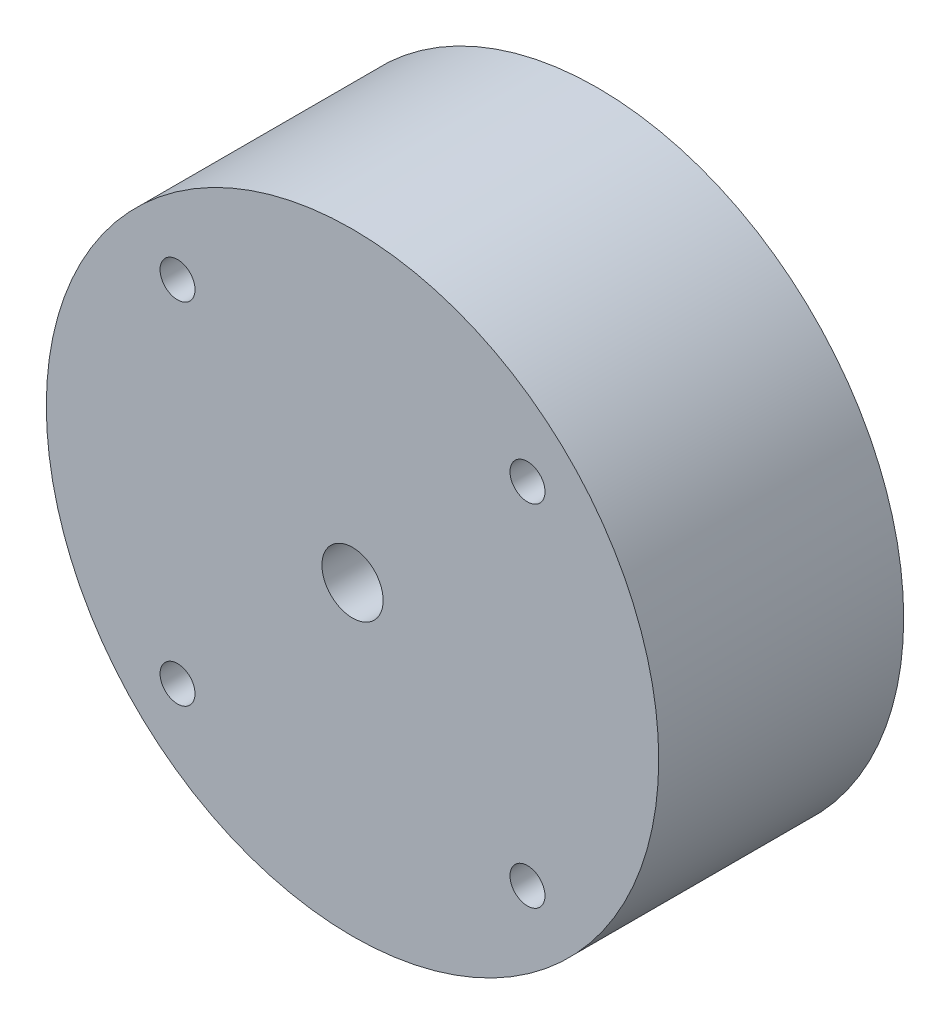
from build123d import *

# Parameters (mm, degrees)
SKETCH1_R           = 17.5
SKETCH1_R_2         = 1.75
BOSS_EXTRUDE1_DEPTH = 14
SKETCH3_R           = 1
CUT_EXTRUDE2_DEPTH  = 29.434134416
CIRPATTERN2_COUNT   = 4


with BuildPart() as part:
    # Sketch1 → Boss-Extrude1 (new body)
    with BuildSketch(Plane.XY):
        Circle(SKETCH1_R)
        Circle(SKETCH1_R_2, mode=Mode.SUBTRACT)
    extrude(amount=BOSS_EXTRUDE1_DEPTH)

    # Sketch3 → Cut-Extrude2 (cut, through all)
    with BuildSketch(Plane.XY.offset(14)):
        with Locations((-10, -10)):
            Circle(SKETCH3_R)
    cut_extrude2 = extrude(amount=-CUT_EXTRUDE2_DEPTH, mode=Mode.SUBTRACT)

    # CirPattern2: Cut-Extrude2 ×4 about axis
    cirpattern2_axis = Axis((0, 0, 14), (0, 0, 1))
    for i in range(1, CIRPATTERN2_COUNT):
        add(cut_extrude2.rotate(cirpattern2_axis, i * 360 / CIRPATTERN2_COUNT), mode=Mode.SUBTRACT)


solid = part.part
